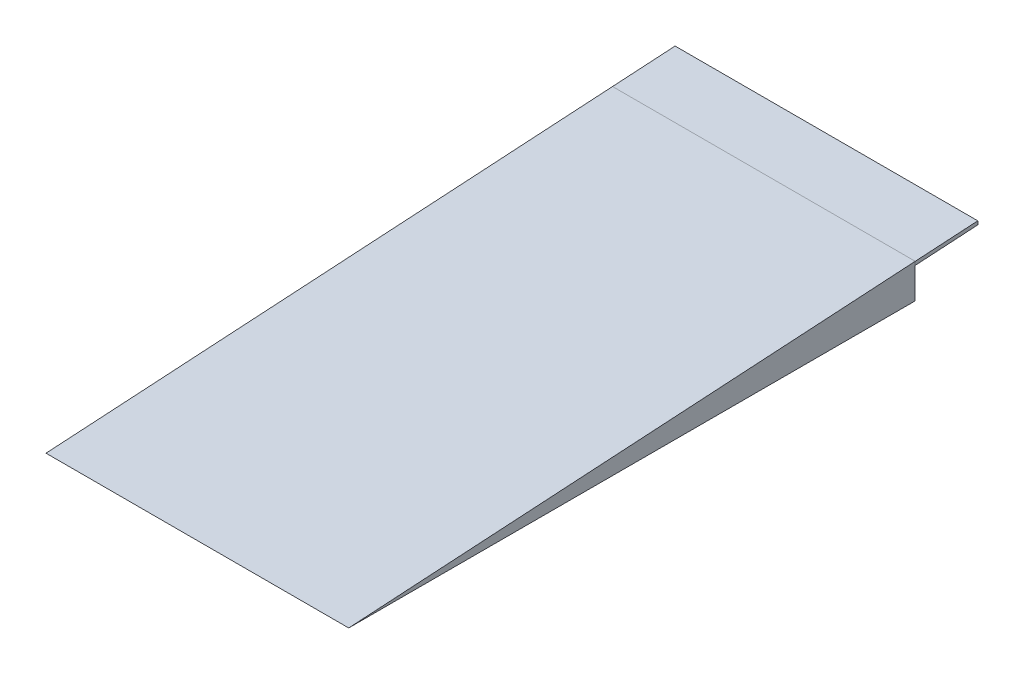
from build123d import *

# Parameters (mm, degrees)
BOSS_EXTRUDE1_DEPTH             = 812.8
SHELL1_T                        = -19.05
BOSS_EXTRUDE2_DEPTH             = 9.525
BOSS_EXTRUDE3_REACH             = 3156.512
BOSS_EXTRUDE3_DIRECTION_2_REACH = 3156.512


with BuildPart() as part:
    # Sketch1 → Boss-Extrude1 (new, symmetric)
    with BuildSketch(Plane(origin=(0, 0, 0), x_dir=(0, 0, -1), z_dir=(1, 0, 0))):
        Polygon((0, 0), (3042.432049775, 184.15), (3042.432049775, 0), align=None)
    extrude(amount=BOSS_EXTRUDE1_DEPTH, both=True)

    # Shell1
    shell1_openings = [part.faces().sort_by_distance(p)[0] for p in [
        (0, 92.075, -3042.432049775),
        (0, 0, -1521.216024888),
    ]]
    offset(amount=SHELL1_T, openings=shell1_openings, kind=Kind.INTERSECTION)

    # Sketch2 → Boss-Extrude2 (add, symmetric)
    with BuildSketch(Plane(origin=(0, 0, 0), x_dir=(0, 0, -1), z_dir=(1, 0, 0))):
        Polygon((315.310344828, 0), (3042.432049775, 0), (3042.432049775, 165.065136624), align=None)
    extrude(amount=BOSS_EXTRUDE2_DEPTH, both=True)


with BuildPart() as body_2:

    # Boss-Extrude3: up to this face of the body (flat: up to its plane)
    boss_extrude3_end = Plane(part.part.faces().sort_by_distance((812.8, 61.383333333, -2028.288033184))[0])
    # Sketch3 → Boss-Extrude3 (new, up to the picked face)
    with BuildSketch(Plane(origin=(0, 0, 0), x_dir=(0, 0, -1), z_dir=(1, 0, 0)), mode=Mode.PRIVATE) as boss_extrude3_sk1:
        Polygon((3042.432049775, 184.15), (3378.367255271, 204.483229167), (3379.518192771, 185.468028856), (3042.432049775, 165.065136624), align=None)
    boss_extrude3_tool1 = split(extrude(boss_extrude3_sk1.sketch, amount=BOSS_EXTRUDE3_REACH, mode=Mode.PRIVATE), bisect_by=boss_extrude3_end, keep=Keep.BOTH, mode=Mode.PRIVATE)
    add(boss_extrude3_tool1.solids().sort_by(Axis((0, 184.786169, -3210.687551), (1, 0, 0)))[0])


    # Boss-Extrude3 direction 2: up to this face of the body (flat: up to its plane)
    boss_extrude3_direction_2_end = Plane(part.part.faces().sort_by_distance((-812.8, 61.383333333, -2028.288033184))[0])
    # Sketch3 → Boss-Extrude3 direction 2 (add, up to the picked face)
    with BuildSketch(Plane(origin=(0, 0, 0), x_dir=(0, 0, -1), z_dir=(1, 0, 0)), mode=Mode.PRIVATE) as boss_extrude3_direction_2_sk1:
        Polygon((3042.432049775, 184.15), (3378.367255271, 204.483229167), (3379.518192771, 185.468028856), (3042.432049775, 165.065136624), align=None)
    boss_extrude3_direction_2_tool1 = split(extrude(boss_extrude3_direction_2_sk1.sketch, amount=-BOSS_EXTRUDE3_DIRECTION_2_REACH, mode=Mode.PRIVATE), bisect_by=boss_extrude3_direction_2_end, keep=Keep.BOTH, mode=Mode.PRIVATE)
    add(boss_extrude3_direction_2_tool1.solids().sort_by(Axis((0, 184.786169, -3210.687551), (-1, 0, 0)))[0])


solid = Compound([part.part, body_2.part])
